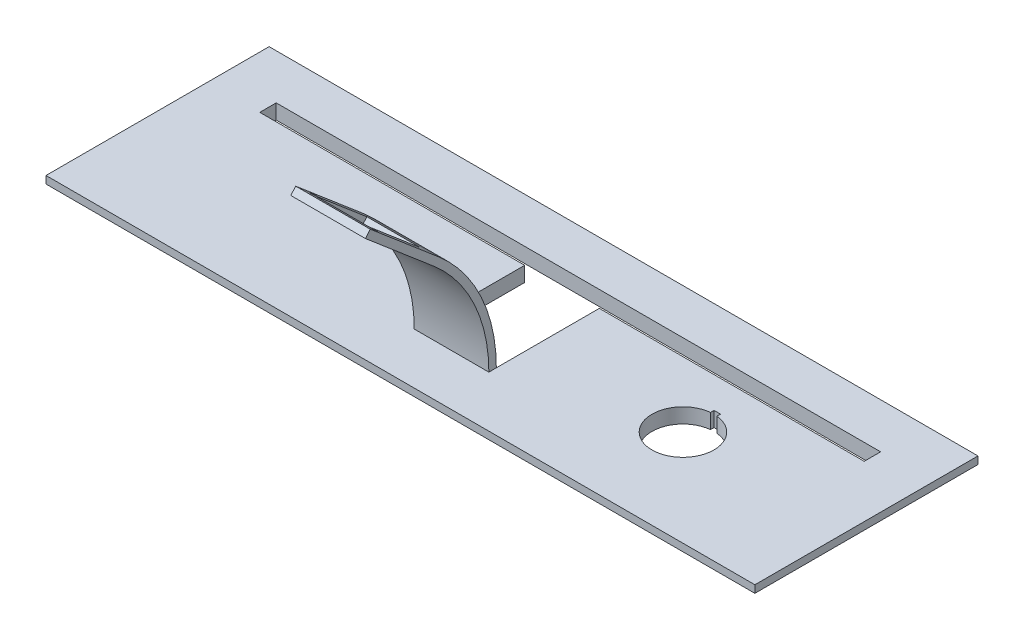
from build123d import *

# Parameters (mm, degrees)
SKETCH1_W                = 234.95
SKETCH1_H                = 69.596
BOSS_EXTRUDE1_DEPTH      = 2.54
SKETCH2_W                = 241.3
SKETCH2_H                = 75.946
BOSS_EXTRUDE2_DEPTH      = 2.54
CUT_EXTRUDE2_DEPTH       = 127.5866408
BOSS_EXTRUDE7_DEPTH      = 12.7
BOSS_EXTRUDE7_DEPTH_BACK = 12.7
SKETCH5_W                = 25.4
SKETCH5_H                = 2.54
BOSS_EXTRUDE8_DEPTH      = 30.48
CUT_EXTRUDE3_REACH       = 153.329
SKETCH6_W                = 18.288
SKETCH6_H                = 23.01875
CUT_EXTRUDE4_REACH       = 153.329
SKETCH9_R                = 1
CUT_EXTRUDE6_REACH       = 151.523


with BuildPart() as part:
    # Sketch1 → Boss-Extrude1 (new body)
    with BuildSketch(Plane(origin=(0, 0, 0), x_dir=(1, 0, 0), z_dir=(0, 1, 0))):
        Rectangle(SKETCH1_W, SKETCH1_H)
    extrude(amount=BOSS_EXTRUDE1_DEPTH)

    # Sketch2 → Boss-Extrude2 (add)
    with BuildSketch(Plane(origin=(0, 2.54, 0), x_dir=(1, 0, 0), z_dir=(0, 1, 0))):
        Rectangle(SKETCH2_W, SKETCH2_H)
    extrude(amount=BOSS_EXTRUDE2_DEPTH)

    # Sketch3 → Cut-Extrude2 (cut, through all)
    with BuildSketch(Plane(origin=(0, 5.08, 0), x_dir=(1, 0, 0), z_dir=(0, 1, 0))):
        Polygon((102.87, 22.606), (-102.87, 22.606), (-102.87, 17.018), (-12.7, 17.018), (-12.7, -18.034), (12.7, -18.034), (12.7, 17.018), (102.87, 17.018), align=None)
    extrude(amount=-CUT_EXTRUDE2_DEPTH, mode=Mode.SUBTRACT)

    # Sketch4 → Boss-Extrude7 (add, two sides: drawn at the far end of the back side and taken through both)
    with BuildSketch(Plane(origin=(0, 0, 0), x_dir=(0, 0, -1), z_dir=(1, 0, 0)).offset(-BOSS_EXTRUDE7_DEPTH_BACK)):
        with BuildLine():
            Line((-20.574, 5.08), (-18.034, 5.08))
            ThreePointArc((-18.034, 5.08), (-23.194025065, 28.533326897), (-37.721134665, 47.655238095))
            Line((-37.721134665, 47.655238095), (-39.366264908, 45.72))
            ThreePointArc((-39.366264908, 45.72), (-25.499478471, 27.467266584), (-20.574, 5.08))
        make_face()
    extrude(amount=BOSS_EXTRUDE7_DEPTH + BOSS_EXTRUDE7_DEPTH_BACK)

    # Sketch5 → Boss-Extrude8 (add)
    with BuildSketch(Plane(origin=(0, 38.605953422, 45.413858329), x_dir=(1, 0, 0), z_dir=(0, 0.6476890718445453, 0.7619047619047618))):
        with Locations((0, 10.607186134)):
            Rectangle(SKETCH5_W, SKETCH5_H)
    extrude(amount=BOSS_EXTRUDE8_DEPTH)

    # Sketch6 → Cut-Extrude3 (cut, up to next)
    with BuildSketch(Plane(origin=(0, 9.049284674, -7.692723663), x_dir=(1, 0, 0), z_dir=(0, 0.7619047619047616, -0.6476890718445452)), mode=Mode.PRIVATE) as cut_extrude3_sk1:
        with Locations((0, -74.455715595)):
            Rectangle(SKETCH6_W, SKETCH6_H)
    cut_extrude3_tool1 = extrude(cut_extrude3_sk1.sketch, amount=-CUT_EXTRUDE3_REACH, mode=Mode.PRIVATE) & part.part
    add(cut_extrude3_tool1.solids().sort_by_distance((0, 57.273438, 49.035441))[0], mode=Mode.SUBTRACT)

    # Sketch9 → Cut-Extrude4 (cut, up to next)
    with BuildSketch(Plane(origin=(0, 9.049284674, -7.692723663), x_dir=(1, 0, 0), z_dir=(0, 0.7619047619047616, -0.6476890718445452)), mode=Mode.PRIVATE) as cut_extrude4_sk1:
        with Locations((-10.31875, -85.171340595)):
            Circle(SKETCH9_R)
    cut_extrude4_tool1 = extrude(cut_extrude4_sk1.sketch, amount=-CUT_EXTRUDE4_REACH, mode=Mode.PRIVATE) & part.part
    # Sketch9 → Cut-Extrude4 (cut, up to next)
    with BuildSketch(Plane(origin=(0, 9.049284674, -7.692723663), x_dir=(1, 0, 0), z_dir=(0, 0.7619047619047616, -0.6476890718445452)), mode=Mode.PRIVATE) as cut_extrude4_sk2:
        with Locations((10.31875, -85.171340595)):
            Circle(SKETCH9_R)
    cut_extrude4_tool2 = extrude(cut_extrude4_sk2.sketch, amount=-CUT_EXTRUDE4_REACH, mode=Mode.PRIVATE) & part.part
    add(cut_extrude4_tool1.solids().sort_by_distance((-10.31875, 64.213831, 57.199726))[0], mode=Mode.SUBTRACT)
    add(cut_extrude4_tool2.solids().sort_by_distance((10.31875, 64.213831, 57.199726))[0], mode=Mode.SUBTRACT)

    # Sketch10 → Cut-Extrude6 (cut, up to next)
    with BuildSketch(Plane(origin=(0, 5.08, 0), x_dir=(1, 0, 0), z_dir=(0, 1, 0)), mode=Mode.PRIVATE) as cut_extrude6_sk1:
        with BuildLine():
            Line((62.300670098, 6.472268969), (64.500670098, 6.472268969))
            Line((64.500670098, 6.472268969), (64.500670098, 5.272268969))
            ThreePointArc((64.500670098, 5.272268969), (63.400670098, -15.752178985), (62.300670098, 5.272268969))
            Line((62.300670098, 5.272268969), (62.300670098, 6.472268969))
        make_face()
    cut_extrude6_tool1 = extrude(cut_extrude6_sk1.sketch, amount=-CUT_EXTRUDE6_REACH, mode=Mode.PRIVATE) & part.part
    add(cut_extrude6_tool1.solids().sort_by_distance((63.40067, 5.08, 5.130488))[0], mode=Mode.SUBTRACT)


solid = part.part
